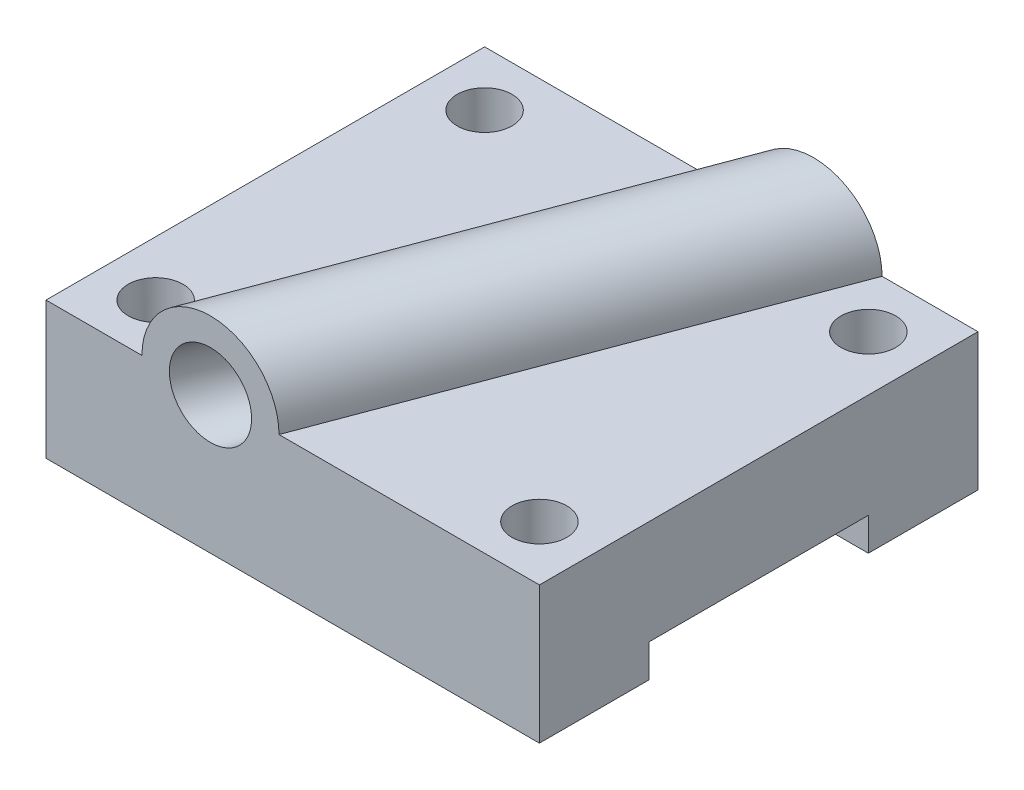
from build123d import *

# Parameters (mm, degrees)
SALIENTE_EXTRUIR1_DEPTH = 90
CORTAR_EXTRUIR1_REACH   = 103.612
CROQUIS2_R              = 5


with BuildPart() as part:
    # Croquis1 → Saliente-Extruir1 (new body)
    with BuildSketch(Plane(origin=(0, 0, 0), x_dir=(0, 0, -1), z_dir=(1, 0, 0))):
        Polygon((-40, 0), (-20, 0), (-20, 6), (20, 6), (20, 0), (40, 0), (40, 25), (-40, 25), align=None)
    extrude(amount=SALIENTE_EXTRUIR1_DEPTH)

    # Croquis2 → Cortar-Extruir1 (cut, up to next)
    with BuildSketch(Plane(origin=(0, 25, 0), x_dir=(1, 0, 0), z_dir=(0, 1, 0)), mode=Mode.PRIVATE) as cortar_extruir1_sk1:
        with Locations(Location((80, -30, 0), (0, 0, 270))):
            Circle(CROQUIS2_R)
    cortar_extruir1_tool1 = extrude(cortar_extruir1_sk1.sketch, amount=-CORTAR_EXTRUIR1_REACH, mode=Mode.PRIVATE) & part.part
    # Croquis2 → Cortar-Extruir1 (cut, up to next)
    with BuildSketch(Plane(origin=(0, 25, 0), x_dir=(1, 0, 0), z_dir=(0, 1, 0)), mode=Mode.PRIVATE) as cortar_extruir1_sk2:
        with Locations(Location((10, -30, 0), (0, 0, 270))):
            Circle(CROQUIS2_R)
    cortar_extruir1_tool2 = extrude(cortar_extruir1_sk2.sketch, amount=-CORTAR_EXTRUIR1_REACH, mode=Mode.PRIVATE) & part.part
    # Croquis2 → Cortar-Extruir1 (cut, up to next)
    with BuildSketch(Plane(origin=(0, 25, 0), x_dir=(1, 0, 0), z_dir=(0, 1, 0)), mode=Mode.PRIVATE) as cortar_extruir1_sk3:
        with Locations(Location((80, 30, 0), (0, 0, 270))):
            Circle(CROQUIS2_R)
    cortar_extruir1_tool3 = extrude(cortar_extruir1_sk3.sketch, amount=-CORTAR_EXTRUIR1_REACH, mode=Mode.PRIVATE) & part.part
    # Croquis2 → Cortar-Extruir1 (cut, up to next)
    with BuildSketch(Plane(origin=(0, 25, 0), x_dir=(1, 0, 0), z_dir=(0, 1, 0)), mode=Mode.PRIVATE) as cortar_extruir1_sk4:
        with Locations(Location((10, 30, 0), (0, 0, 270))):
            Circle(CROQUIS2_R)
    cortar_extruir1_tool4 = extrude(cortar_extruir1_sk4.sketch, amount=-CORTAR_EXTRUIR1_REACH, mode=Mode.PRIVATE) & part.part
    add(cortar_extruir1_tool1.solids().sort_by_distance((80, 25, 30))[0], mode=Mode.SUBTRACT)
    add(cortar_extruir1_tool2.solids().sort_by_distance((10, 25, 30))[0], mode=Mode.SUBTRACT)
    add(cortar_extruir1_tool3.solids().sort_by_distance((80, 25, -30))[0], mode=Mode.SUBTRACT)
    add(cortar_extruir1_tool4.solids().sort_by_distance((10, 25, -30))[0], mode=Mode.SUBTRACT)

    # Croquis4 → Recubrir4 section 0
    with BuildSketch(Plane.XY.offset(40)):
        with BuildLine():
            Line((17.5, 25), (42.5, 25))
            ThreePointArc((42.5, 25), (30, 37.5), (17.5, 25))
        make_face()
    # Croquis3 → Recubrir4 section 1
    with BuildSketch(Plane(origin=(0, 0, -40), x_dir=(-1, 0, 0), z_dir=(0, 0, -1))):
        with BuildLine():
            Line((-72.5, 25), (-47.5, 25))
            ThreePointArc((-47.5, 25), (-60, 37.5), (-72.5, 25))
        make_face()
    loft()

    # Cortar-Recubrir1: read off the stored shape, not the designer's step
    # Cortar-Recubrir1: loft between two sections, ruled curve by curve
    cortar_recubrir1_from = [
        Edge.make_bspline([(66.474673977, 28.785313314, -40), (66.159231201, 29.324869479, -40), (65.736792303, 29.896857571, -40), (64.865302784, 30.721785457, -40), (64.535116198, 30.990385277, -40), (63.787281531, 31.48910574, -40), (63.369421529, 31.719151625, -40), (62.447680858, 32.106958451, -40), (61.943610916, 32.26447662, -40), (60.867132061, 32.469827705, -40), (60.294709068, 32.517257966, -40), (59.119137062, 32.471285113, -40), (58.516285627, 32.377485336, -40), (57.333561907, 32.036960006, -40), (56.754242851, 31.790116754, -40), (55.675130521, 31.159231201, -40), (55.17584807, 30.775487545, -40), (54.298935855, 29.911880072, -40), (53.921474907, 29.432556086, -40), (53.304749619, 28.430691343, -40), (53.065285592, 27.908604481, -40), (52.716177882, 26.869807291, -40), (52.606176412, 26.353282213, -40), (52.491969247, 25.359825257, -40), (52.487459152, 24.882847533, -40), (52.555211917, 23.986528197, -40), (52.627305677, 23.567038585, -40), (52.918664408, 22.402946626, -40), (53.209883246, 21.754242851, -40), (53.840768799, 20.675130521, -40), (54.263207697, 20.103142429, -40), (55.134697216, 19.278214543, -40), (55.464883802, 19.009614723, -40), (56.212718469, 18.51089426, -40), (56.630578471, 18.280848375, -40), (57.552319142, 17.893041549, -40), (58.056389084, 17.73552338, -40), (59.132867939, 17.530172295, -40), (59.705290932, 17.482742034, -40), (60.880862938, 17.528714887, -40), (61.483714373, 17.622514664, -40), (62.666438093, 17.963039994, -40), (63.245757149, 18.209883246, -40), (64.324869479, 18.840768799, -40), (64.82415193, 19.224512455, -40), (65.701064145, 20.088119928, -40), (66.078525093, 20.567443914, -40), (66.695250381, 21.569308657, -40), (66.934714408, 22.091395519, -40), (67.283822118, 23.130192709, -40), (67.393823588, 23.646717787, -40), (67.508030753, 24.640174743, -40), (67.512540848, 25.117152467, -40), (67.444788083, 26.013471803, -40), (67.372694323, 26.432961415, -40), (67.081335592, 27.597053374, -40), (66.790116754, 28.245757149, -40), (66.474673977, 28.785313314, -40)], [0, 0, 0, 0, 0.0625, 0.0625, 0.09375, 0.09375, 0.125, 0.125, 0.15625, 0.15625, 0.1875, 0.1875, 0.21875, 0.21875, 0.25, 0.25, 0.28125, 0.28125, 0.3125, 0.3125, 0.34375, 0.34375, 0.375, 0.375, 0.40625, 0.40625, 0.4375, 0.4375, 0.5, 0.5, 0.5625, 0.5625, 0.59375, 0.59375, 0.625, 0.625, 0.65625, 0.65625, 0.6875, 0.6875, 0.71875, 0.71875, 0.75, 0.75, 0.78125, 0.78125, 0.8125, 0.8125, 0.84375, 0.84375, 0.875, 0.875, 0.90625, 0.90625, 0.9375, 0.9375, 1, 1, 1, 1], 3),
    ]
    cortar_recubrir1_to = [
        Edge.make_bspline([(29.971725733, 32.499946704, 40), (29.346730174, 32.497590515, 40), (28.640021711, 32.418925734, 40), (27.489296584, 32.078585195, 40), (27.091335491, 31.927601711, 40), (26.284847367, 31.530668849, 40), (25.876278751, 31.284498632, 40), (25.078546377, 30.681486974, 40), (24.689497752, 30.324360039, 40), (23.972030096, 29.495978512, 40), (23.643952375, 29.024509827, 40), (23.094236484, 27.984367777, 40), (22.873090724, 27.415752966, 40), (22.574631411, 26.22171991, 40), (22.497697107, 25.596721292, 40), (22.502409485, 24.346730174, 40), (22.584053936, 23.722329387, 40), (22.891507477, 22.53058058, 40), (23.116934166, 21.963649315, 40), (23.674476843, 20.927681551, 40), (24.006099995, 20.458699891, 40), (24.729793048, 19.635751438, 40), (25.121523263, 19.281567984, 40), (25.923779519, 18.684588169, 40), (26.334192585, 18.441505455, 40), (27.143650559, 18.050664595, 40), (27.542738719, 17.902685931, 40), (28.69599722, 17.571031246, 40), (29.403278708, 17.497697107, 40), (30.653269826, 17.502409485, 40), (31.359978289, 17.581074266, 40), (32.510703416, 17.921414805, 40), (32.908664509, 18.072398289, 40), (33.715152633, 18.469331151, 40), (34.123721249, 18.715501368, 40), (34.921453623, 19.318513026, 40), (35.310502248, 19.675639961, 40), (36.027969904, 20.504021488, 40), (36.356047625, 20.975490173, 40), (36.905763516, 22.015632223, 40), (37.126909276, 22.584247034, 40), (37.425368589, 23.77828009, 40), (37.502302893, 24.403278708, 40), (37.497590515, 25.653269826, 40), (37.415946064, 26.277670613, 40), (37.108492523, 27.46941942, 40), (36.883065834, 28.036350685, 40), (36.325523157, 29.072318449, 40), (35.993900005, 29.541300109, 40), (35.270206952, 30.364248562, 40), (34.878476737, 30.718432016, 40), (34.076220481, 31.315411831, 40), (33.665807415, 31.558494545, 40), (32.856349441, 31.949335405, 40), (32.457261281, 32.097314069, 40), (31.30400278, 32.428968754, 40), (30.596721292, 32.502302893, 40), (29.971725733, 32.499946704, 40)], [0, 0, 0, 0, 0.0625, 0.0625, 0.09375, 0.09375, 0.125, 0.125, 0.15625, 0.15625, 0.1875, 0.1875, 0.21875, 0.21875, 0.25, 0.25, 0.28125, 0.28125, 0.3125, 0.3125, 0.34375, 0.34375, 0.375, 0.375, 0.40625, 0.40625, 0.4375, 0.4375, 0.5, 0.5, 0.5625, 0.5625, 0.59375, 0.59375, 0.625, 0.625, 0.65625, 0.65625, 0.6875, 0.6875, 0.71875, 0.71875, 0.75, 0.75, 0.78125, 0.78125, 0.8125, 0.8125, 0.84375, 0.84375, 0.875, 0.875, 0.90625, 0.90625, 0.9375, 0.9375, 1, 1, 1, 1], 3),
    ]
    cortar_recubrir1 = Solid(Shell([*[Face.make_surface_from_curves(cortar_recubrir1_from[k], cortar_recubrir1_to[k]) for k in range(1)], Face(Wire(cortar_recubrir1_from)), Face(Wire(cortar_recubrir1_to))]))
    add(cortar_recubrir1, mode=Mode.SUBTRACT)


solid = part.part
